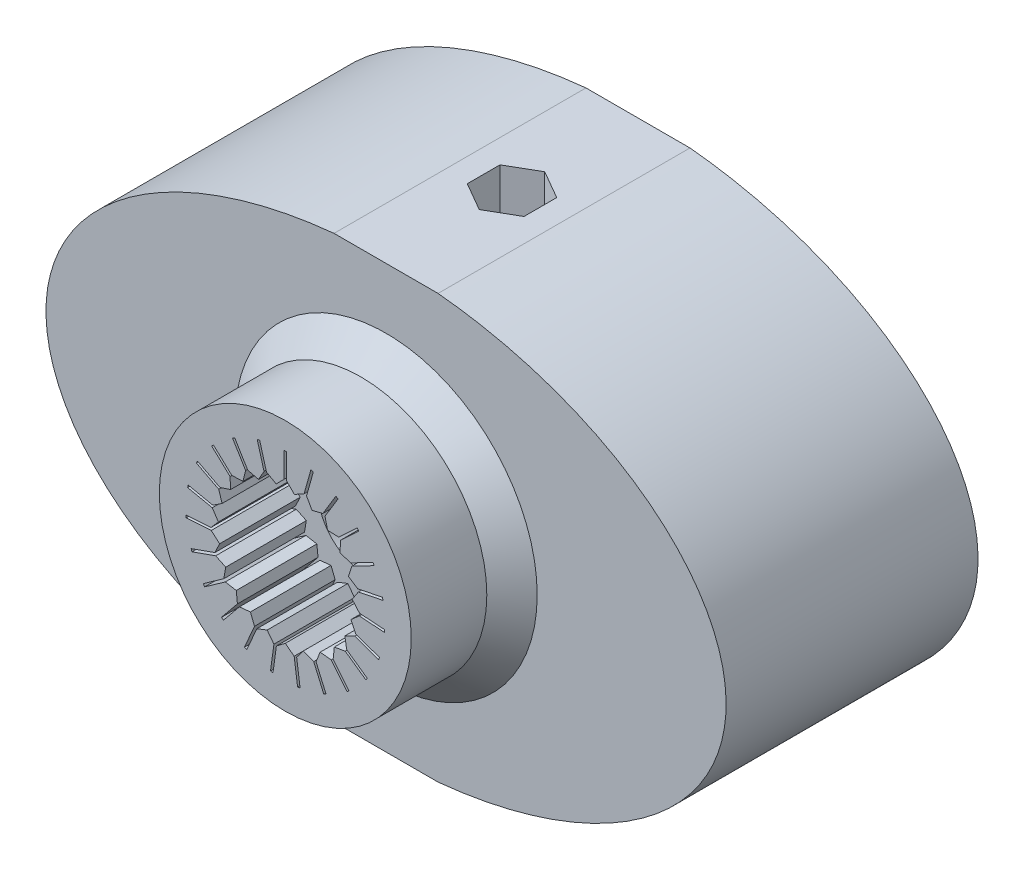
from build123d import *

# Parameters (mm, degrees)
SKETCH_1_RX              = 13.5
SKETCH_1_RY              = 8.5
EXTRUDE_1_DEPTH          = 10
CUT_EXTRUDE_START        = 18.4
SKETCH_2_W               = 5
SKETCH_2_H               = 16.987350845
CUT_EXTRUDE_2_DEPTH      = 10
CUT_EXTRUDE_3_DEPTH      = 24.758998465
CUT_EXTRUDE_3_DEPTH_BACK = 24.758998465
SKETCH_6_R               = 5
EXTRUDE_3_DEPTH          = 4
CUT_EXTRUDE_5_DEPTH      = 3.2
CHAMFER_1_SIZE           = 1
SKETCH_7_R               = 1.9
CUT_EXTRUDE_6_DEPTH      = 20.221082346
SKETCH_8_R               = 3
CUT_EXTRUDE_7_DEPTH      = 6


with BuildPart() as part:
    # ｽｹｯﾁ1 → ﾎﾞｽ - 押し出し1 (new body)
    with BuildSketch(Plane.XY):
        with Locations(Location((0, 0), (0, 0, 180))):
            Ellipse(SKETCH_1_RX, SKETCH_1_RY)
    extrude(amount=EXTRUDE_1_DEPTH)

    # ｽｹｯﾁ2 → ｶｯﾄ - 押し出し2 (cut)
    with BuildSketch(Plane(origin=(0, 0, 0), x_dir=(1, 0, 0), z_dir=(0, 1, 0)).offset(CUT_EXTRUDE_START)):
        with Locations((0, -4.794388707)):
            Rectangle(SKETCH_2_W, SKETCH_2_H)
    cut_extrude_2 = extrude(amount=-CUT_EXTRUDE_2_DEPTH, mode=Mode.SUBTRACT)

    # ﾐﾗｰ1: ｶｯﾄ - 押し出し2 across plane
    add(cut_extrude_2.mirror(Plane.ZX), mode=Mode.SUBTRACT)

    # ｽｹｯﾁ3 → ｶｯﾄ - 押し出し3 (cut, two sides: drawn at the far end of the back side and taken through both)
    with BuildSketch(Plane(origin=(0, 8.4, 0), x_dir=(1, 0, 0), z_dir=(0, 1, 0)).offset(-CUT_EXTRUDE_3_DEPTH_BACK)):
        Polygon((1.125833025, -5.65), (1.125833025, -4.35), (0, -3.7), (-1.125833025, -4.35), (-1.125833025, -5.65), (0, -6.3), align=None)
    extrude(amount=CUT_EXTRUDE_3_DEPTH + CUT_EXTRUDE_3_DEPTH_BACK, mode=Mode.SUBTRACT)

    # ｽｹｯﾁ6 → ﾎﾞｽ - 押し出し3 (add)
    with BuildSketch(Plane.XY.offset(10)):
        Circle(SKETCH_6_R)
    extrude(amount=EXTRUDE_3_DEPTH)

    # ｽｹｯﾁ5 → ｶｯﾄ - 押し出し5 (cut)
    with BuildSketch(Plane.XY.offset(14)):
        Polygon((-0.05, 2.95), (-0.05, 3.95), (0.05, 3.95), (0.05, 2.95), (0.362514094, 2.637485906), (0.747754611, 2.854095836), (1.017551382, 3.817013124), (1.11384311, 3.790033446), (0.844046339, 2.827116159), (1.060656269, 2.441875642), (1.490051682, 2.546516441), (2.009635632, 3.400935845), (2.095077573, 3.34897745), (1.575493623, 2.494558046), (1.680134421, 2.065162633), (2.121838437, 2.050073571), (2.852674402, 2.732626714), (2.920929716, 2.659543117), (2.190093752, 1.976989974), (2.17500469, 1.535285958), (2.596258142, 1.401586122), (3.484143361, 1.86165116), (3.530149865, 1.772862638), (2.642264646, 1.3127976), (2.50856481, 0.891544148), (2.878125258, 0.649149443), (3.857209346, 0.852605456), (3.877554947, 0.754697047), (2.898470859, 0.551241034), (2.656076155, 0.181680586), (2.94653499, -0.151431681), (3.944203759, -0.219674094), (3.937379518, -0.319440971), (2.939710748, -0.251198558), (2.606598481, -0.541657393), (2.796413701, -0.94078181), (3.738674623, -1.275661422), (3.705186662, -1.369887514), (2.76292574, -1.035007902), (2.363801323, -1.224823122), (2.4388952, -1.660358456), (3.255865093, -2.237038778), (3.198197061, -2.318735767), (2.381227168, -1.742055445), (1.945691834, -1.817149322), (1.900495, -2.25679391), (2.531582945, -3.032505201), (2.454011816, -3.095613995), (1.822923871, -2.319902705), (1.383279283, -2.274705871), (1.22114378, -2.685853285), (1.61954487, -3.603064586), (1.52782374, -3.642904695), (1.12942265, -2.725693394), (0.718275236, -2.563557891), (0.451225912, -2.915715208), (0.587392561, -3.906401154), (0.488323967, -3.920017819), (0.352157318, -2.929331873), (0, -2.66228255), (-0.352157318, -2.929331873), (-0.488323967, -3.920017819), (-0.587392561, -3.906401154), (-0.451225912, -2.915715208), (-0.718275236, -2.563557891), (-1.12942265, -2.725693394), (-1.52782374, -3.642904695), (-1.61954487, -3.603064586), (-1.22114378, -2.685853285), (-1.383279283, -2.274705871), (-1.822923871, -2.319902705), (-2.454011816, -3.095613995), (-2.531582945, -3.032505201), (-1.900495, -2.25679391), (-1.945691834, -1.817149322), (-2.381227168, -1.742055445), (-3.198197061, -2.318735767), (-3.255865093, -2.237038778), (-2.4388952, -1.660358456), (-2.363801323, -1.224823122), (-2.76292574, -1.035007902), (-3.705186662, -1.369887514), (-3.738674623, -1.275661422), (-2.796413701, -0.94078181), (-2.606598481, -0.541657393), (-2.939710748, -0.251198558), (-3.937379518, -0.319440971), (-3.944203759, -0.219674094), (-2.94653499, -0.151431681), (-2.656076155, 0.181680586), (-2.898470859, 0.551241034), (-3.877554947, 0.754697047), (-3.857209346, 0.852605456), (-2.878125258, 0.649149443), (-2.50856481, 0.891544148), (-2.642264646, 1.3127976), (-3.530149865, 1.772862638), (-3.484143361, 1.86165116), (-2.596258142, 1.401586122), (-2.17500469, 1.535285958), (-2.190093752, 1.976989974), (-2.920929716, 2.659543117), (-2.852674402, 2.732626714), (-2.121838437, 2.050073571), (-1.680134421, 2.065162633), (-1.575493623, 2.494558046), (-2.095077573, 3.34897745), (-2.009635632, 3.400935845), (-1.490051682, 2.546516441), (-1.060656269, 2.441875642), (-0.844046339, 2.827116159), (-1.11384311, 3.790033446), (-1.017551382, 3.817013124), (-0.747754611, 2.854095836), (-0.362514094, 2.637485906), align=None)
    extrude(amount=-CUT_EXTRUDE_5_DEPTH, mode=Mode.SUBTRACT)

    # 面取り1
    chamfer_1_edges = [part.edges().sort_by_distance(p)[0] for p in [
        (-5, 0, 10),
    ]]
    chamfer(chamfer_1_edges, length=CHAMFER_1_SIZE)

    # ｽｹｯﾁ7 → ｶｯﾄ - 押し出し6 (cut, through all)
    with BuildSketch(Plane.XY.offset(10.8)):
        Circle(SKETCH_7_R)
    extrude(amount=-CUT_EXTRUDE_6_DEPTH, mode=Mode.SUBTRACT)

    # ｽｹｯﾁ8 → ｶｯﾄ - 押し出し7 (cut)
    with BuildSketch(Plane(origin=(0, 0, 0), x_dir=(-1, 0, 0), z_dir=(0, 0, -1))):
        Circle(SKETCH_8_R)
    extrude(amount=-CUT_EXTRUDE_7_DEPTH, mode=Mode.SUBTRACT)


solid = part.part
